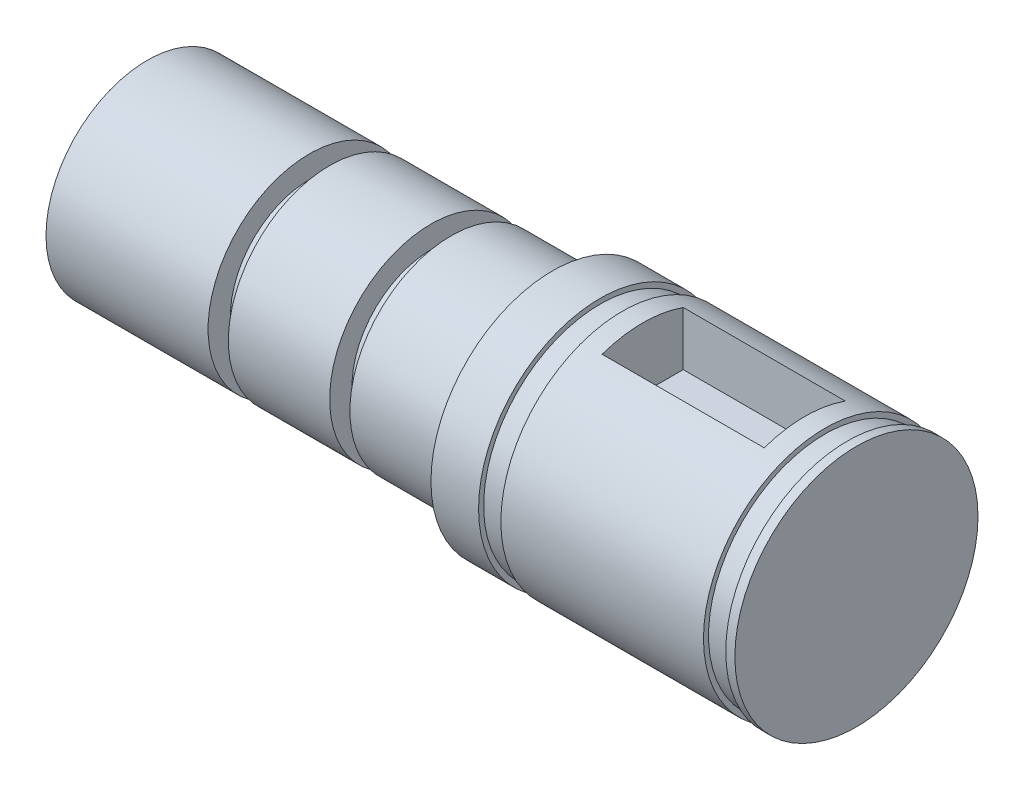
from build123d import *

# Parameters (mm, degrees)
SKETCH1_R           = 6
BOSS_EXTRUDE1_DEPTH = 15
SKETCH2_R           = 5
BOSS_EXTRUDE2_DEPTH = 20
SKETCH3_W           = 8
SKETCH3_H           = 4
CUT_EXTRUDE1_DEPTH  = 3
SKETCH4_W           = 1
SKETCH4_H           = 1.1
SKETCH4_W_2         = 1.1
SKETCH4_H_2         = 0.25


with BuildPart() as part:
    # Sketch1 → Boss-Extrude1 (new body)
    with BuildSketch(Plane(origin=(0, 0, 0), x_dir=(0, 0, -1), z_dir=(1, 0, 0))):
        Circle(SKETCH1_R)
    extrude(amount=BOSS_EXTRUDE1_DEPTH)

    # Sketch2 → Boss-Extrude2 (add)
    with BuildSketch(Plane.ZY):
        Circle(SKETCH2_R)
    extrude(amount=BOSS_EXTRUDE2_DEPTH)

    # Sketch3 → Cut-Extrude1 (cut)
    with BuildSketch(Plane(origin=(0, 6, 0), x_dir=(1, 0, 0), z_dir=(0, 1, 0))):
        with Locations((8.45, 0)):
            Rectangle(SKETCH3_W, SKETCH3_H)
    extrude(amount=-CUT_EXTRUDE1_DEPTH, mode=Mode.SUBTRACT)

    # Sketch4 → Cut-Revolve1 (revolve, cut)
    with BuildSketch(Plane.XY):
        with Locations((-5.5, 4.45)):
            Rectangle(SKETCH4_W, SKETCH4_H)
        with Locations((-11.5, 4.45)):
            Rectangle(SKETCH4_W, SKETCH4_H)
        with Locations((2.9, 5.875)):
            Rectangle(SKETCH4_W_2, SKETCH4_H_2)
        with Locations((14, 5.875)):
            Rectangle(SKETCH4_W_2, SKETCH4_H_2)
    revolve(axis=Axis((0, 0, 0), (-1, 0, 0)), mode=Mode.SUBTRACT)


solid = part.part
